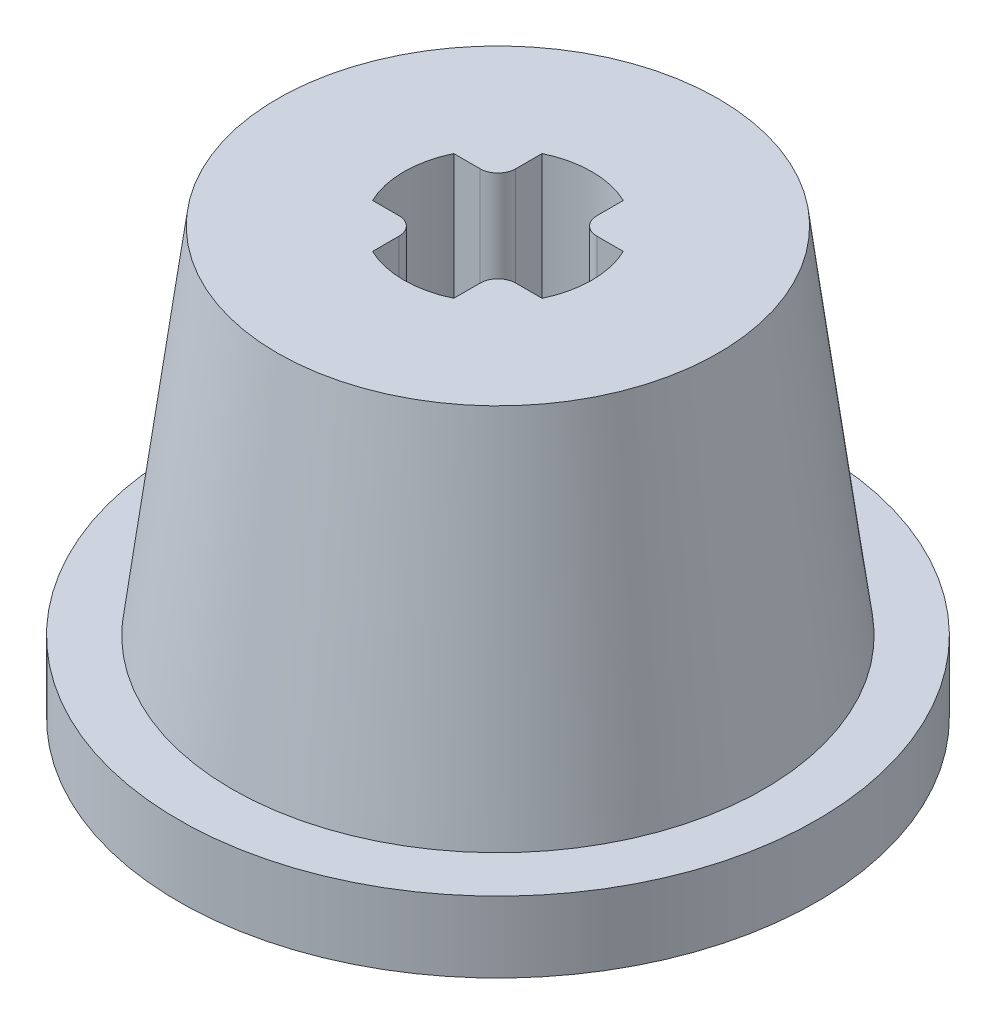
from build123d import *

# Parameters (mm, degrees)
SKETCH1_R           = 7.5
BOSS_EXTRUDE1_DEPTH = 10
SKETCH3_R           = 9
BOSS_EXTRUDE2_DEPTH = 2
CUT_EXTRUDE1_DEPTH  = 18.492855685
FILLET1_R           = 0.5


with BuildPart() as part:
    # Sketch1 → Boss-Extrude1 (new body)
    with BuildSketch(Plane(origin=(0, 0, 0), x_dir=(1, 0, 0), z_dir=(0, 1, 0))):
        Circle(SKETCH1_R)
    extrude(amount=BOSS_EXTRUDE1_DEPTH)

    # Sketch2 → Cut-Revolve1 (revolve, cut)
    with BuildSketch(Plane(origin=(0, 0, 0), x_dir=(0, 0, -1), z_dir=(1, 0, 0))):
        Polygon((-7.5, 0), (-6.213648186, 10), (-7.5, 10), align=None)
    revolve(axis=Axis((0, 0, 0), (0, 1, 0)), mode=Mode.SUBTRACT)

    # Sketch3 → Boss-Extrude2 (add)
    with BuildSketch(Plane(origin=(0, 0, 0), x_dir=(-1, 0, 0), z_dir=(0, -1, 0))):
        Circle(SKETCH3_R)
    extrude(amount=BOSS_EXTRUDE2_DEPTH)

    # Sketch4 → Cut-Extrude1 (cut, through all)
    with BuildSketch(Plane.XZ.offset(2)):
        with BuildLine():
            ThreePointArc((-1.145, -2.389869243), (0, -2.65), (1.145, -2.389869243))
            Line((1.145, -2.389869243), (1.145, -1.145))
            Line((1.145, -1.145), (2.389869243, -1.145))
            ThreePointArc((2.389869243, -1.145), (2.65, 0), (2.389869243, 1.145))
            Line((2.389869243, 1.145), (1.145, 1.145))
            Line((1.145, 1.145), (1.145, 2.389869243))
            ThreePointArc((1.145, 2.389869243), (0, 2.65), (-1.145, 2.389869243))
            Line((-1.145, 2.389869243), (-1.145, 1.145))
            Line((-1.145, 1.145), (-2.389869243, 1.145))
            ThreePointArc((-2.389869243, 1.145), (-2.65, 0), (-2.389869243, -1.145))
            Line((-2.389869243, -1.145), (-1.145, -1.145))
            Line((-1.145, -1.145), (-1.145, -2.389869243))
        make_face()
    extrude(amount=-CUT_EXTRUDE1_DEPTH, mode=Mode.SUBTRACT)

    # Fillet1
    fillet1_edges = [part.edges().sort_by_distance(p)[0] for p in [
        (1.145, 4, 1.145),
        (1.145, 4, -1.145),
        (-1.145, 4, -1.145),
        (-1.145, 4, 1.145),
    ]]
    fillet(fillet1_edges, radius=FILLET1_R)


solid = part.part
